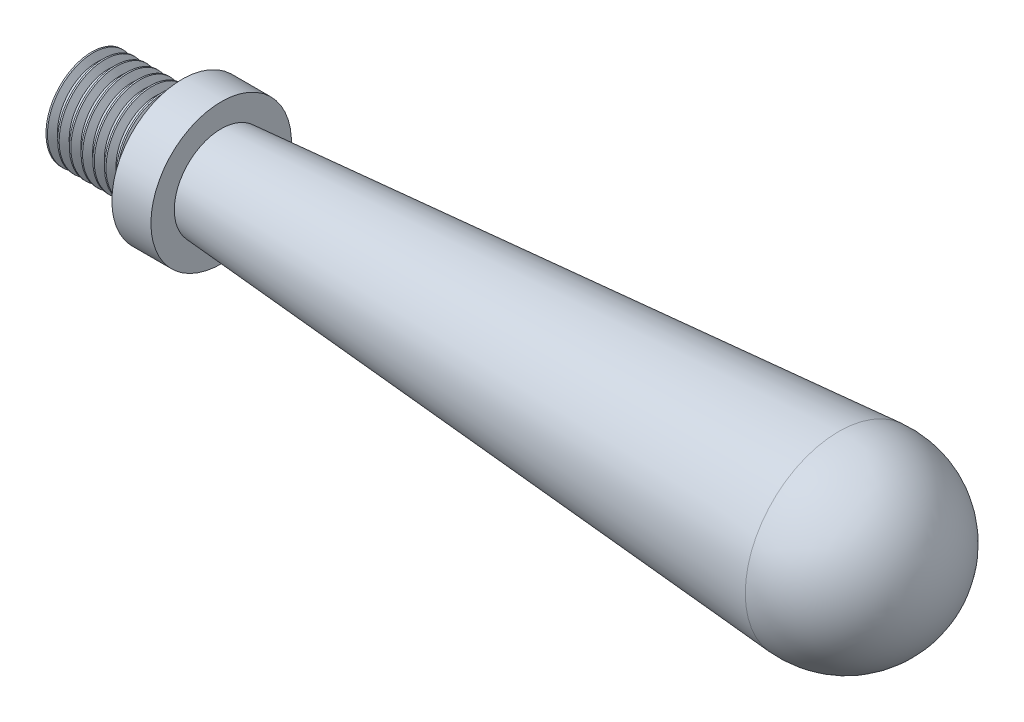
from build123d import *

# Parameters (mm, degrees)
THREAD1_PITCH = 1.5


with BuildPart() as part:
    # Sketch1 → Revolve1 (revolve)
    with BuildSketch(Plane.XY, mode=Mode.PRIVATE) as revolve1_sk:
        with BuildLine():
            Line((0, 0), (0, 6))
            Line((0, 6), (12, 6))
            Line((12, 6), (12, 9))
            Line((12, 9), (17, 9))
            Line((17, 9), (17, 6))
            Line((17, 6), (96.09745078, 11.966010401))
            ThreePointArc((96.09745078, 11.966010401), (105.15994514, 8.798596213), (109, 0))
            Line((109, 0), (0, 0))
        make_face()
    revolve(revolve1_sk.sketch.rotate(Axis((0, 0, 0), (1, 0, 0)), 90), axis=Axis((0, 0, 0), (1, 0, 0)))

    # Thread1: the profile of Thread Profile1 profile screwed along a right-hand helix of 10 turns, 8 arcs to a turn; built about Z, then put on its axis
    thread1_z = Axis((0, 0, 0), (0, 0, 1))
    thread1_corners = [(6.0003, 0, -0.000173205), (6.0003, 0, 1.312673201), (5.188101188, 0, 0.843749998), (5.188101188, 0, 0.468749998)]
    with BuildLine(mode=Mode.PRIVATE) as thread1_profile:
        Line(thread1_corners[0], thread1_corners[1])
        Line(thread1_corners[1], thread1_corners[2])
        Line(thread1_corners[2], thread1_corners[3])
        Line(thread1_corners[3], thread1_corners[0])
    thread1_cap = Face(thread1_profile.wire())
    thread1_turn_angles = [0, 22.5, 45, 67.5, 90, 112.5, 135, 157.5, 180, 202.5, 225, 247.5, 270, 292.5, 315, 337.5, 360]
    thread1_turn_weights = [1, 0.9238795325112867, 1, 0.9238795325112867, 1, 0.9238795325112867, 1, 0.9238795325112867, 1, 0.9238795325112867, 1, 0.9238795325112867, 1, 0.9238795325112867, 1, 0.9238795325112867, 1]
    thread1_turn_rails = [Edge.make_bspline([Vector(p[0], p[1], 0).rotate(thread1_z, thread1_turn_angles[k]) / thread1_turn_weights[k] + Vector(0, 0, p[2] + THREAD1_PITCH * thread1_turn_angles[k] / 360) for k in range(17)], [0, 0, 0, 1, 1, 2, 2, 3, 3, 4, 4, 5, 5, 6, 6, 7, 7, 8, 8, 8], 2, thread1_turn_weights) for p in thread1_corners]
    thread1_turn_sides = [Face.make_surface_from_curves(thread1_turn_rails[p[0]], thread1_turn_rails[p[1]]) for p in [(0, 1), (1, 2), (2, 3), (3, 0)]]
    thread1 = Plane(origin=(-3, 0, 0), x_dir=(0, 0, -1), z_dir=(1, 0, 0)) * Solid(Shell([*[p.moved(Location((0, 0, THREAD1_PITCH * i))) for i in range(10) for p in thread1_turn_sides], thread1_cap, thread1_cap.rotate(thread1_z, 3600).moved(Location((0, 0, THREAD1_PITCH * 3600 / 360)))]))
    add(thread1, mode=Mode.SUBTRACT)


solid = part.part
